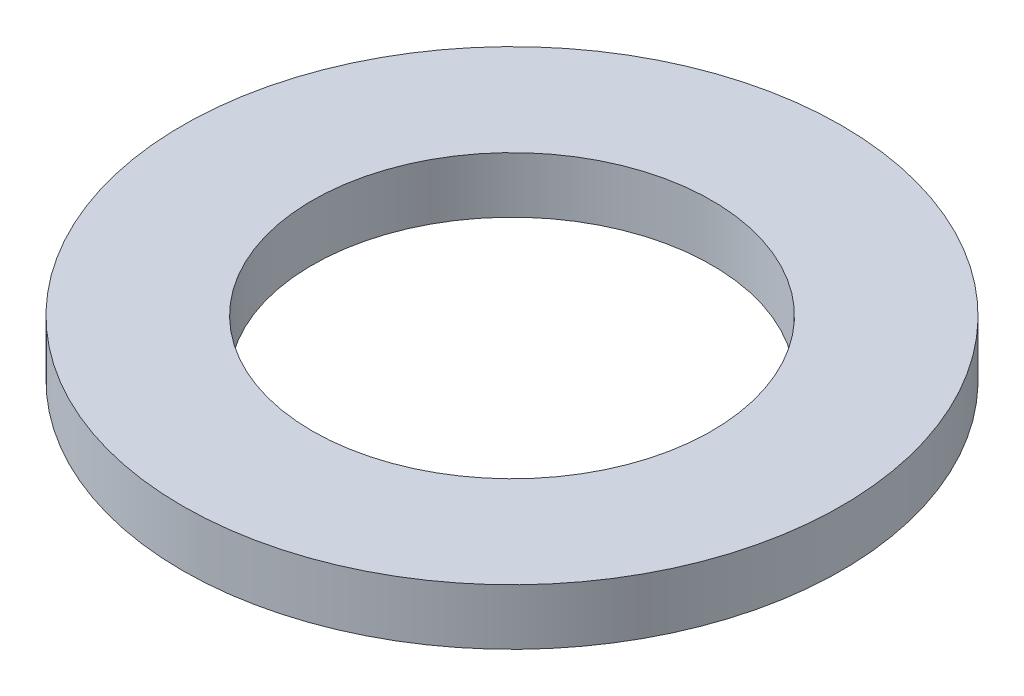
from build123d import *

# Parameters (mm, degrees)
SKETCH1_R           = 82.5
BOSS_EXTRUDE1_DEPTH = 14
SKETCH2_R           = 50
CUT_EXTRUDE1_DEPTH  = 118.509574078


with BuildPart() as part:
    # Sketch1 → Boss-Extrude1 (new body)
    with BuildSketch(Plane(origin=(0, 0, 0), x_dir=(1, 0, 0), z_dir=(0, 1, 0))):
        Circle(SKETCH1_R)
    extrude(amount=BOSS_EXTRUDE1_DEPTH)

    # Sketch2 → Cut-Extrude1 (cut, through all)
    with BuildSketch(Plane(origin=(0, 0, 0), x_dir=(1, 0, 0), z_dir=(0, 1, 0))):
        Circle(SKETCH2_R)
    extrude(amount=CUT_EXTRUDE1_DEPTH, mode=Mode.SUBTRACT)


solid = part.part
